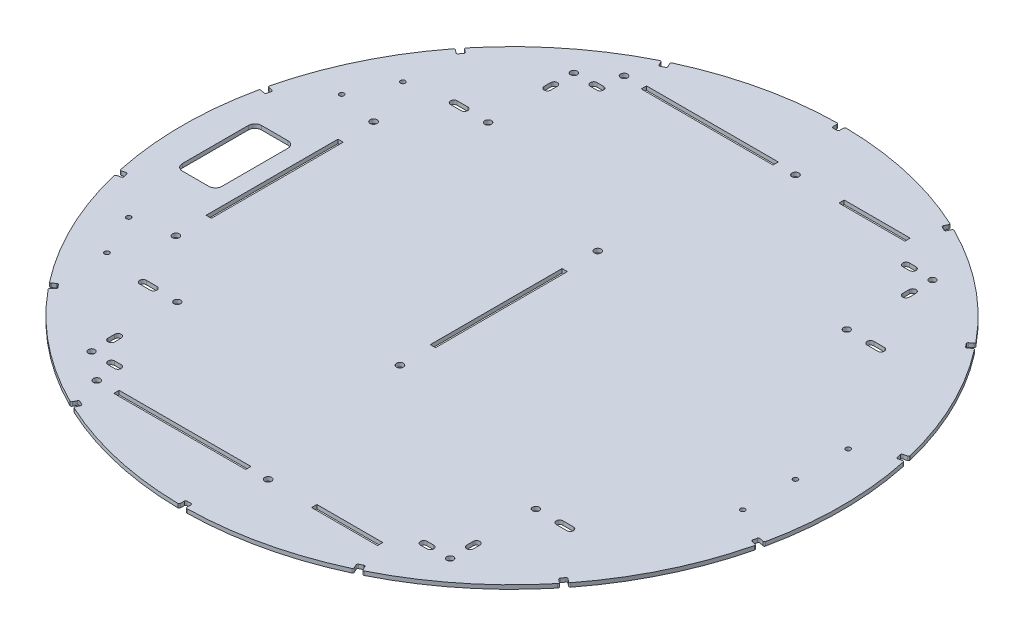
from build123d import *

# Parameters (mm, degrees)
SKETCH1_R                = 250
BOSS_EXTRUDE1_DEPTH      = 3
CUT_EXTRUDE5_DEPTH       = 4
FILLET1_R                = 1
CIRPATTERN1_COUNT        = 14
FILLET1_OF_CIRPATTERN1_R = 1
SKETCH17_W               = 4
SKETCH17_H               = 100
CUT_EXTRUDE11_DEPTH      = 10
SKETCH18_R               = 2.6
CUT_EXTRUDE12_DEPTH      = 10
CUT_EXTRUDE14_DEPTH      = 14
SKETCH21_R               = 2.6
SKETCH21_W               = 100
SKETCH21_H               = 4
CUT_EXTRUDE15_DEPTH      = 14
SKETCH22_R               = 2.5
CUT_EXTRUDE16_DEPTH      = 14
CUT_EXTRUDE17_DEPTH      = 14
SKETCH25_W               = 50
SKETCH25_H               = 4
CUT_EXTRUDE18_DEPTH      = 4
CUT_EXTRUDE19_DEPTH      = 4
SKETCH27_R               = 1.8
CUT_EXTRUDE20_DEPTH      = 10
SKETCH28_R               = 1.8
CUT_EXTRUDE21_DEPTH      = 10


with BuildPart() as part:
    # Sketch1 → Boss-Extrude1 (new body)
    with BuildSketch(Plane(origin=(0, 0, 0), x_dir=(1, 0, 0), z_dir=(0, 1, 0))):
        Circle(SKETCH1_R)
    extrude(amount=BOSS_EXTRUDE1_DEPTH)

    # Sketch11 → Cut-Extrude5 (cut)
    with BuildSketch(Plane(origin=(0, 3, 0), x_dir=(1, 0, 0), z_dir=(0, 1, 0))):
        with BuildLine():
            Line((1.5, 245), (-1.5, 245))
            ThreePointArc((-1.5, 245), (-2.207106781, 245.292893219), (-2.5, 246))
            Line((-2.5, 246), (-2.5, 255))
            Line((-2.5, 255), (2.5, 255))
            Line((2.5, 255), (2.5, 246))
            ThreePointArc((2.5, 246), (2.207106781, 245.292893219), (1.5, 245))
        make_face()
    cut_extrude5 = extrude(amount=-CUT_EXTRUDE5_DEPTH, mode=Mode.SUBTRACT)

    # Fillet1
    fillet1_edges = [part.edges().sort_by_distance(p)[0] for p in [
        (2.5, 1.5, -249.987499687),
        (-2.5, 1.5, -249.987499687),
    ]]
    fillet(fillet1_edges, radius=FILLET1_R)

    # CirPattern1: Cut-Extrude5 ×14 about axis
    cirpattern1_axis = Axis((0, 3, 0), (0, -1, 0))
    for i in range(1, CIRPATTERN1_COUNT):
        add(cut_extrude5.rotate(cirpattern1_axis, i * 360 / CIRPATTERN1_COUNT), mode=Mode.SUBTRACT)

    # Fillet1 of CirPattern1
    fillet1_of_cirpattern1_edges = [part.edges().sort_by_distance(p)[0] for p in [
        (110.717933267, 1.5, -224.146245235),
        (106.213088927, 1.5, -226.315663931),
        (197.006821984, 1.5, -153.910077941),
        (193.889372974, 1.5, -157.819235353),
        (244.276093477, 1.5, -53.190132127),
        (243.163488807, 1.5, -58.064771688),
        (243.163488807, 1.5, 58.064771688),
        (244.276093477, 1.5, 53.190132127),
        (193.889372974, 1.5, 157.819235353),
        (197.006821984, 1.5, 153.910077941),
        (106.213088927, 1.5, 226.315663931),
        (110.717933267, 1.5, 224.146245235),
        (-2.5, 1.5, 249.987499687),
        (2.5, 1.5, 249.987499687),
        (-110.717933267, 1.5, 224.146245235),
        (-106.213088927, 1.5, 226.315663931),
        (-197.006821984, 1.5, 153.910077941),
        (-193.889372974, 1.5, 157.819235353),
        (-244.276093477, 1.5, 53.190132127),
        (-243.163488807, 1.5, 58.064771688),
        (-243.163488807, 1.5, -58.064771688),
        (-244.276093477, 1.5, -53.190132127),
        (-193.889372974, 1.5, -157.819235353),
        (-197.006821984, 1.5, -153.910077941),
        (-106.213088927, 1.5, -226.315663931),
        (-110.717933267, 1.5, -224.146245235),
    ]]
    fillet(fillet1_of_cirpattern1_edges, radius=FILLET1_OF_CIRPATTERN1_R)

    # Sketch17 → Cut-Extrude11 (cut)
    with BuildSketch(Plane(origin=(0, 3, 0), x_dir=(1, 0, 0), z_dir=(0, 1, 0))):
        with Locations((-10, 0)):
            Rectangle(SKETCH17_W, SKETCH17_H)
        with Locations((-180, 0)):
            Rectangle(SKETCH17_W, SKETCH17_H)
    extrude(amount=-CUT_EXTRUDE11_DEPTH, mode=Mode.SUBTRACT)

    # Sketch18 → Cut-Extrude12 (cut)
    with BuildSketch(Plane(origin=(0, 3, 0), x_dir=(1, 0, 0), z_dir=(0, 1, 0))):
        with Locations((-180, 75)):
            Circle(SKETCH18_R)
        with Locations((-180, -75)):
            Circle(SKETCH18_R)
        with Locations((-10, 75)):
            Circle(SKETCH18_R)
        with Locations((-10, -75)):
            Circle(SKETCH18_R)
    extrude(amount=-CUT_EXTRUDE12_DEPTH, mode=Mode.SUBTRACT)

    # Sketch20 → Cut-Extrude14 (cut)
    with BuildSketch(Plane.XZ):
        with BuildLine():
            Line((-162, -115.4), (-154, -115.4))
            ThreePointArc((-154, -115.4), (-151.5, -117.9), (-154, -120.4))
            Line((-154, -120.4), (-162, -120.4))
            ThreePointArc((-162, -120.4), (-164.5, -117.9), (-162, -115.4))
        make_face()
        with BuildLine():
            Line((162, -115.4), (154, -115.4))
            ThreePointArc((154, -115.4), (151.5, -117.9), (154, -120.4))
            Line((154, -120.4), (162, -120.4))
            ThreePointArc((162, -120.4), (164.5, -117.9), (162, -115.4))
        make_face()
        with BuildLine():
            Line((162, 115.4), (154, 115.4))
            ThreePointArc((154, 115.4), (151.5, 117.9), (154, 120.4))
            Line((154, 120.4), (162, 120.4))
            ThreePointArc((162, 120.4), (164.5, 117.9), (162, 115.4))
        make_face()
        with BuildLine():
            Line((-162, 115.4), (-154, 115.4))
            ThreePointArc((-154, 115.4), (-151.5, 117.9), (-154, 120.4))
            Line((-154, 120.4), (-162, 120.4))
            ThreePointArc((-162, 120.4), (-164.5, 117.9), (-162, 115.4))
        make_face()
    extrude(amount=-CUT_EXTRUDE14_DEPTH, mode=Mode.SUBTRACT)

    # Sketch21 → Cut-Extrude15 (cut)
    with BuildSketch(Plane(origin=(0, 3, 0), x_dir=(1, 0, 0), z_dir=(0, 1, 0))):
        with Locations((-115, 200)):
            Circle(SKETCH21_R)
        with Locations((15, 200)):
            Circle(SKETCH21_R)
        with Locations((15, -200)):
            Circle(SKETCH21_R)
        with Locations((-115, -200)):
            Circle(SKETCH21_R)
        with Locations((-50, 200)):
            Rectangle(SKETCH21_W, SKETCH21_H)
        with Locations((-50, -200)):
            Rectangle(SKETCH21_W, SKETCH21_H)
    extrude(amount=-CUT_EXTRUDE15_DEPTH, mode=Mode.SUBTRACT)

    # Sketch22 → Cut-Extrude16 (cut)
    with BuildSketch(Plane(origin=(0, 3, 0), x_dir=(1, 0, 0), z_dir=(0, 1, 0))):
        with Locations((-136, -117.9)):
            Circle(SKETCH22_R)
        with Locations((-136, 117.9)):
            Circle(SKETCH22_R)
        with Locations((136, 117.9)):
            Circle(SKETCH22_R)
        with Locations((136, -117.9)):
            Circle(SKETCH22_R)
        with Locations((-136, 182.9)):
            Circle(SKETCH22_R)
        with Locations((136, 182.9)):
            Circle(SKETCH22_R)
        with Locations((-136, -182.9)):
            Circle(SKETCH22_R)
        with Locations((136, -182.9)):
            Circle(SKETCH22_R)
    extrude(amount=-CUT_EXTRUDE16_DEPTH, mode=Mode.SUBTRACT)

    # Sketch24 → Cut-Extrude17 (cut)
    with BuildSketch(Plane.XZ):
        with BuildLine():
            Line((-200, -30), (-220, -30))
            ThreePointArc((-220, -30), (-223.535533906, -28.535533906), (-225, -25))
            Line((-225, -25), (-225, 25))
            ThreePointArc((-225, 25), (-223.535533906, 28.535533906), (-220, 30))
            Line((-220, 30), (-200, 30))
            ThreePointArc((-200, 30), (-196.464466094, 28.535533906), (-195, 25))
            Line((-195, 25), (-195, -25))
            ThreePointArc((-195, -25), (-196.464466094, -28.535533906), (-200, -30))
        make_face()
    extrude(amount=-CUT_EXTRUDE17_DEPTH, mode=Mode.SUBTRACT)

    # Sketch25 → Cut-Extrude18 (cut)
    with BuildSketch(Plane(origin=(0, 3, 0), x_dir=(1, 0, 0), z_dir=(0, 1, 0))):
        with Locations((75, 200)):
            Rectangle(SKETCH25_W, SKETCH25_H)
        with Locations((75, -200)):
            Rectangle(SKETCH25_W, SKETCH25_H)
    extrude(amount=-CUT_EXTRUDE18_DEPTH, mode=Mode.SUBTRACT)

    # Sketch26 → Cut-Extrude19 (cut)
    with BuildSketch(Plane(origin=(0, 3, 0), x_dir=(1, 0, 0), z_dir=(0, 1, 0))):
        with BuildLine():
            Line((-138.5, 162.9), (-138.5, 167.9))
            ThreePointArc((-138.5, 167.9), (-136, 170.4), (-133.5, 167.9))
            Line((-133.5, 167.9), (-133.5, 162.9))
            ThreePointArc((-133.5, 162.9), (-136, 160.4), (-138.5, 162.9))
        make_face()
        with BuildLine():
            Line((-116, 180.4), (-121, 180.4))
            ThreePointArc((-121, 180.4), (-123.5, 182.9), (-121, 185.4))
            Line((-121, 185.4), (-116, 185.4))
            ThreePointArc((-116, 185.4), (-113.5, 182.9), (-116, 180.4))
        make_face()
        with BuildLine():
            Line((116, 180.4), (121, 180.4))
            ThreePointArc((121, 180.4), (123.5, 182.9), (121, 185.4))
            Line((121, 185.4), (116, 185.4))
            ThreePointArc((116, 185.4), (113.5, 182.9), (116, 180.4))
        make_face()
        with BuildLine():
            Line((138.5, 162.9), (138.5, 167.9))
            ThreePointArc((138.5, 167.9), (136, 170.4), (133.5, 167.9))
            Line((133.5, 167.9), (133.5, 162.9))
            ThreePointArc((133.5, 162.9), (136, 160.4), (138.5, 162.9))
        make_face()
        with BuildLine():
            Line((116, -180.4), (121, -180.4))
            ThreePointArc((121, -180.4), (123.5, -182.9), (121, -185.4))
            Line((121, -185.4), (116, -185.4))
            ThreePointArc((116, -185.4), (113.5, -182.9), (116, -180.4))
        make_face()
        with BuildLine():
            Line((138.5, -162.9), (138.5, -167.9))
            ThreePointArc((138.5, -167.9), (136, -170.4), (133.5, -167.9))
            Line((133.5, -167.9), (133.5, -162.9))
            ThreePointArc((133.5, -162.9), (136, -160.4), (138.5, -162.9))
        make_face()
        with BuildLine():
            Line((-138.5, -162.9), (-138.5, -167.9))
            ThreePointArc((-138.5, -167.9), (-136, -170.4), (-133.5, -167.9))
            Line((-133.5, -167.9), (-133.5, -162.9))
            ThreePointArc((-133.5, -162.9), (-136, -160.4), (-138.5, -162.9))
        make_face()
        with BuildLine():
            Line((-116, -180.4), (-121, -180.4))
            ThreePointArc((-121, -180.4), (-123.5, -182.9), (-121, -185.4))
            Line((-121, -185.4), (-116, -185.4))
            ThreePointArc((-116, -185.4), (-113.5, -182.9), (-116, -180.4))
        make_face()
    extrude(amount=-CUT_EXTRUDE19_DEPTH, mode=Mode.SUBTRACT)

    # Sketch27 → Cut-Extrude20 (cut)
    with BuildSketch(Plane(origin=(0, 3, 0), x_dir=(1, 0, 0), z_dir=(0, 1, 0))):
        with Locations((215, 0)):
            Circle(SKETCH27_R)
        with Locations((215, 40)):
            Circle(SKETCH27_R)
        with Locations((215, -40)):
            Circle(SKETCH27_R)
    extrude(amount=-CUT_EXTRUDE20_DEPTH, mode=Mode.SUBTRACT)

    # Sketch28 → Cut-Extrude21 (cut)
    with BuildSketch(Plane(origin=(0, 3, 0), x_dir=(1, 0, 0), z_dir=(0, 1, 0))):
        with Locations((-210, 80.777472107)):
            Circle(SKETCH28_R)
        with Locations((-195, 112.249721603)):
            Circle(SKETCH28_R)
        with Locations((-210, -80.777472107)):
            Circle(SKETCH28_R)
        with Locations((-195, -112.249721603)):
            Circle(SKETCH28_R)
    extrude(amount=-CUT_EXTRUDE21_DEPTH, mode=Mode.SUBTRACT)


solid = part.part
